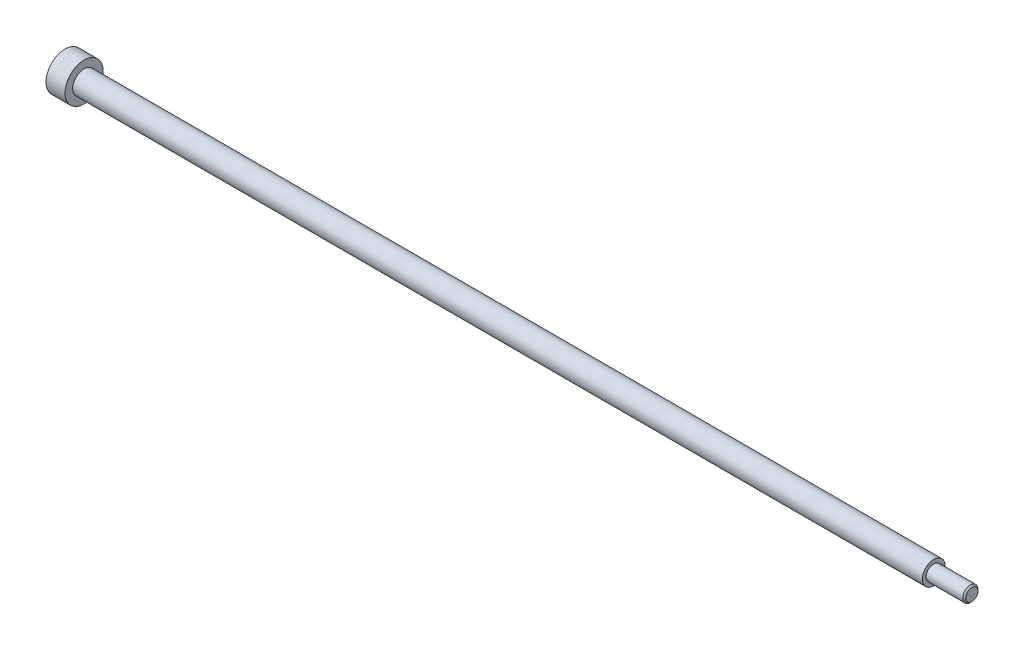
from build123d import *

# Parameters (mm, degrees)
SKETCH2_R           = 2.75
BOSS_EXTRUDE1_DEPTH = 10


# Read off the part's stored shape, not the designer's step: M4 Machine Threads Stud1
with BuildPart() as part:
    # Sketch1 → Revolve1 (revolve)
    with BuildSketch(Plane.XY):
        Polygon((0, 0), (0, 5), (5, 5), (5, 3), (228, 3), (228, 0), align=None)
    revolve(axis=Axis((228, 0, 0), (-1, 0, 0)))

    # Sketch2 → Boss-Extrude1 (add)
    with BuildSketch(Plane(origin=(228, 0, 0), x_dir=(0, 0, -1), z_dir=(1, 0, 0))):
        with Locations(Location((0, 0, 0), (0, 0, 90))):
            Circle(SKETCH2_R)
    extrude(amount=BOSS_EXTRUDE1_DEPTH)

    # M4 Machine Threads Stud1 outline → M4 Machine Threads Stud1 (revolve, cut)
    with BuildSketch(Plane.YX):
        Polygon((2, 237.61), (2, 228), (2.75, 228), (2.75, 238), (1.61, 238), align=None)
    revolve(axis=Axis((0, 0, 0), (1, 0, 0)), mode=Mode.SUBTRACT)


solid = part.part
